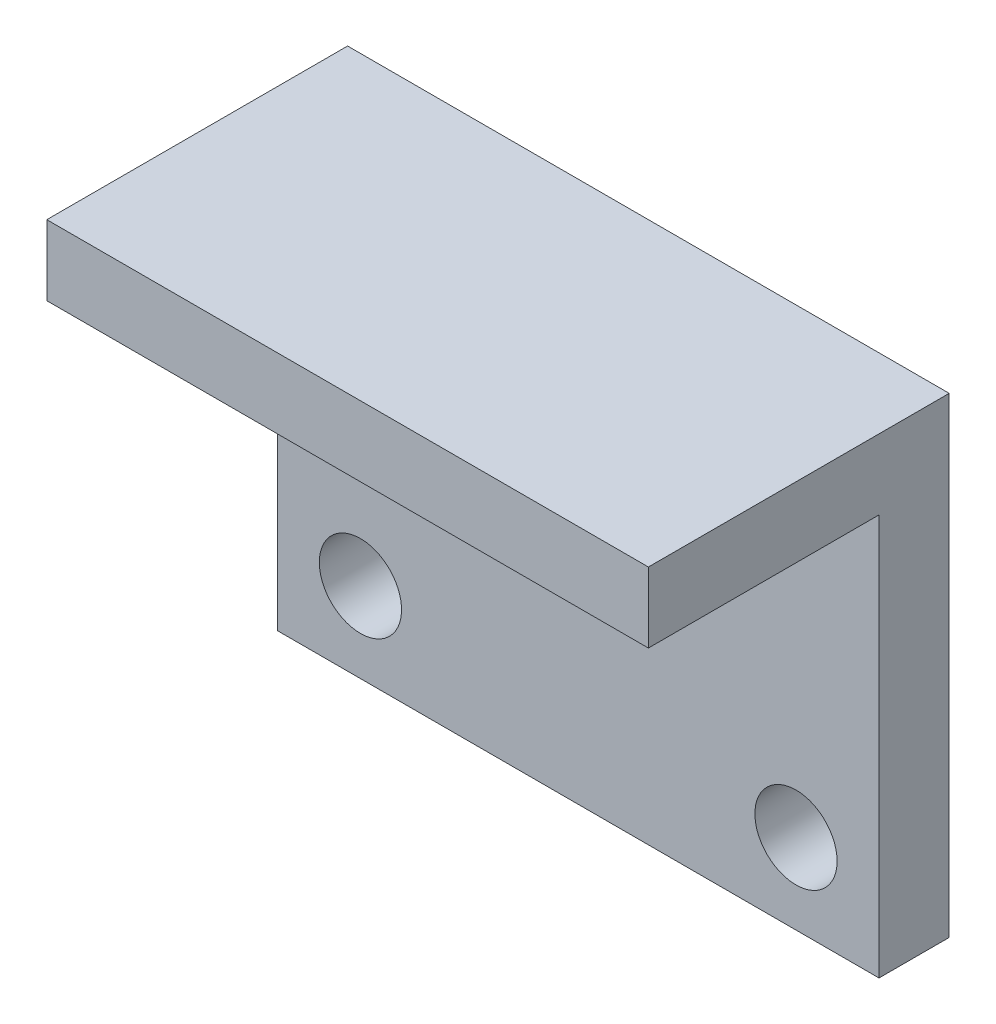
from build123d import *

# Parameters (mm, degrees)
SKETCH4_W           = 30
SKETCH4_H           = 20
SKETCH4_R           = 2.05
BOSS_EXTRUDE2_DEPTH = 3.5
SKETCH5_W           = 30
SKETCH5_H           = 3.5
BOSS_EXTRUDE3_DEPTH = 15


with BuildPart() as part:
    # Sketch4 → Boss-Extrude2 (new body)
    with BuildSketch(Plane.XY):
        Rectangle(SKETCH4_W, SKETCH4_H)
        with Locations((10.86, -6)):
            Circle(SKETCH4_R, mode=Mode.SUBTRACT)
        with Locations((-10.86, -6)):
            Circle(SKETCH4_R, mode=Mode.SUBTRACT)
    extrude(amount=BOSS_EXTRUDE2_DEPTH)

    # Sketch5 → Boss-Extrude3 (add)
    with BuildSketch(Plane.XY):
        with Locations((0, 11.75)):
            Rectangle(SKETCH5_W, SKETCH5_H)
    extrude(amount=BOSS_EXTRUDE3_DEPTH)


solid = part.part
